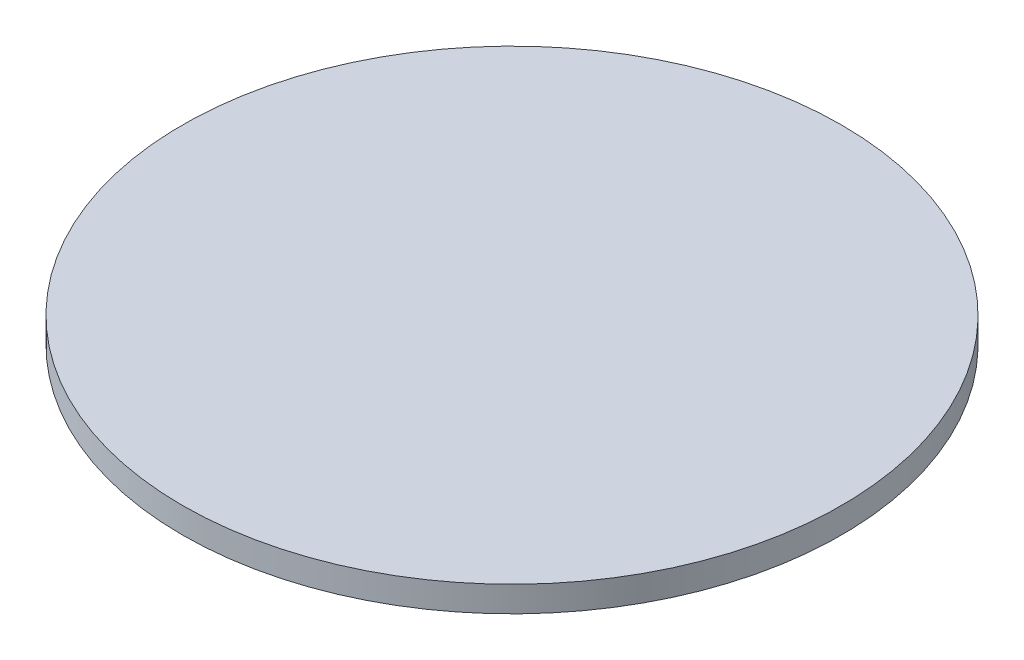
from build123d import *

# Parameters (mm, degrees)
SKETCH1_R           = 45
BOSS_EXTRUDE1_DEPTH = 3.5
CAVITY1_DEPTH       = 2.5


# Read off the part's stored shape, not the designer's step: Cavity1
with BuildPart() as part:
    # Sketch1 → Boss-Extrude1 (new body)
    with BuildSketch(Plane(origin=(0, 0, 0), x_dir=(1, 0, 0), z_dir=(0, 1, 0))):
        with Locations(Location((0, 0, 0), (0, 0, 270))):
            Circle(SKETCH1_R)
    extrude(amount=BOSS_EXTRUDE1_DEPTH)

    # Cavity1 outline → Cavity1 (cut)
    with BuildSketch(Plane(origin=(0, 0, 0), x_dir=(1, 0, 0), z_dir=(0, 1, 0))):
        with BuildLine():
            ThreePointArc((-1.897013309, 4.206804256), (-1.35975038, 3.69058849), (-0.614681205, 3.689140702))
            ThreePointArc((-0.614681205, 3.689140702), (27.363668078, -7.605415279), (17.306098008, -36.05186159))
            ThreePointArc((17.306098008, -36.05186159), (16.813923428, -36.611231194), (16.845129248, -37.355647991))
            ThreePointArc((16.845129248, -37.355647991), (17.423389863, -37.887377997), (18.207362086, -37.837281165))
            ThreePointArc((18.207362086, -37.837281165), (29.186869676, -6.783262051), (-1.356143814, 5.546621038))
            ThreePointArc((-1.356143814, 5.546621038), (-1.91270489, 4.992218741), (-1.897013309, 4.206804256))
        make_face()
        with BuildLine():
            ThreePointArc((1.897013309, -4.206804256), (1.35975038, -3.69058849), (0.614681205, -3.689140702))
            ThreePointArc((0.614681205, -3.689140702), (-27.363668078, 7.605415279), (-17.306098008, 36.05186159))
            ThreePointArc((-17.306098008, 36.05186159), (-16.813923428, 36.611231194), (-16.845129248, 37.355647991))
            ThreePointArc((-16.845129248, 37.355647991), (-17.423389863, 37.887377997), (-18.207362086, 37.837281165))
            ThreePointArc((-18.207362086, 37.837281165), (-29.186869676, 6.783262051), (1.356143814, -5.546621038))
            ThreePointArc((1.356143814, -5.546621038), (1.91270489, -4.992218741), (1.897013309, -4.206804256))
        make_face()
    extrude(amount=CAVITY1_DEPTH, mode=Mode.SUBTRACT)


solid = part.part
